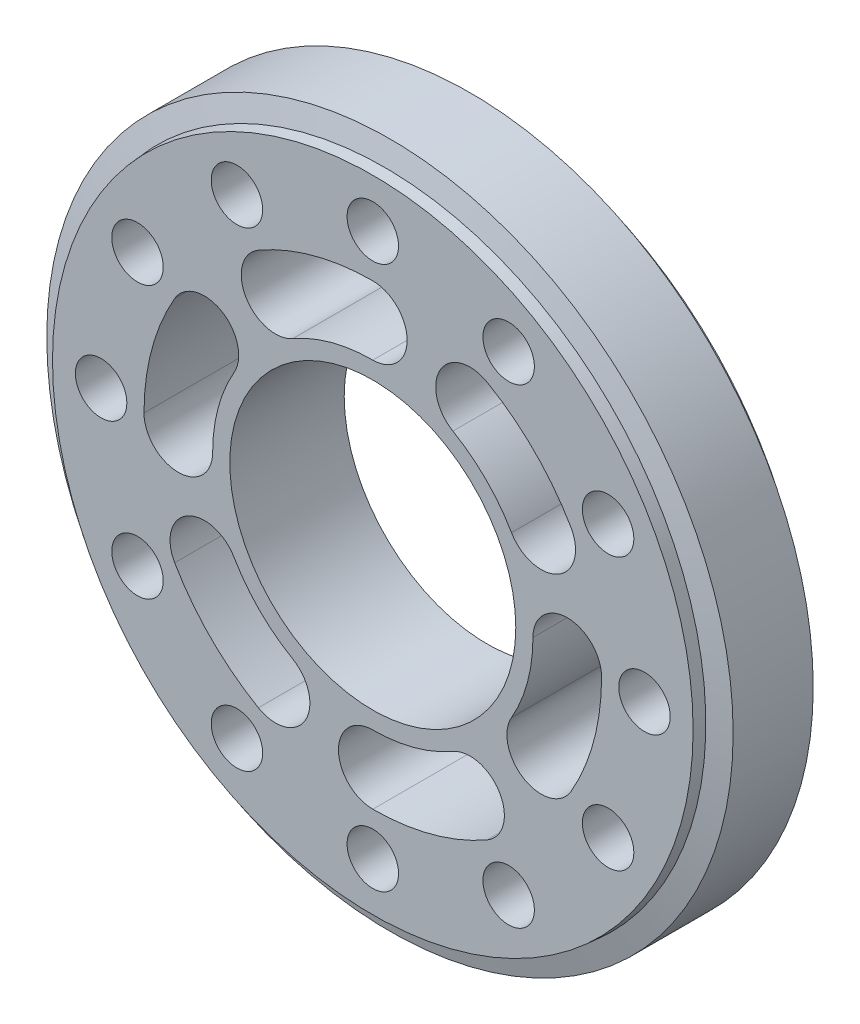
from build123d import *

# Parameters (mm, degrees)
SKETCH2_R          = 2.25
SKETCH2_R_2        = 12.5
CUT_EXTRUDE1_DEPTH = 12
CHAMFER1_SIZE2     = 2
CHAMFER1_SIZE      = 0.5
CHAMFER2_SIZE      = 0.5
CHAMFER2_SIZE_2    = 2
CUT_EXTRUDE2_DEPTH = 20
CIRPATTERN1_COUNT  = 6
DRAFT2_ANGLE       = 5


# Read off the part's stored shape, not the designer's step: Draft1
# Some blends are built 0.0001 mm under size
with BuildPart() as part:
    # Sketch1 → Revolve1 (revolve)
    with BuildSketch(Plane(origin=(0, 0, 0), x_dir=(0, 0, -1), z_dir=(1, 0, 0)), mode=Mode.PRIVATE) as revolve1_sk:
        Polygon((0, 0), (0, 30), (4, 30), (4, 28), (5, 28), (5, 0), align=None)
    revolve(revolve1_sk.sketch.rotate(Axis((0, 0, 0), (0, 0, 1)), 90), axis=Axis((0, 0, 0), (0, 0, 1)))

    # Mirror1: part across plane


with BuildPart() as part_1:
    add(part.part)
    add(part.part.mirror(Plane.XY))

    # Sketch2 → Cut-Extrude1 (cut)
    with BuildSketch(Plane.XY.offset(5)):
        with Locations((0, 23.75)):
            Circle(SKETCH2_R)
        with Locations((-11.875, 20.56810334)):
            Circle(SKETCH2_R)
        with Locations((-20.56810334, 11.875)):
            Circle(SKETCH2_R)
        with Locations((-23.75, 0)):
            Circle(SKETCH2_R)
        with Locations((-20.56810334, -11.875)):
            Circle(SKETCH2_R)
        with Locations((-11.875, -20.56810334)):
            Circle(SKETCH2_R)
        with Locations((0, -23.75)):
            Circle(SKETCH2_R)
        with Locations((11.875, -20.56810334)):
            Circle(SKETCH2_R)
        with Locations((20.56810334, -11.875)):
            Circle(SKETCH2_R)
        with Locations((20.56810334, 11.875)):
            Circle(SKETCH2_R)
        with Locations((11.875, 20.56810334)):
            Circle(SKETCH2_R)
        Circle(SKETCH2_R_2)
        with Locations((23.75, 0)):
            Circle(SKETCH2_R)
    extrude(amount=-CUT_EXTRUDE1_DEPTH, mode=Mode.SUBTRACT)

    # Chamfer1
    chamfer1_edges = [part_1.edges().sort_by_distance(p)[0] for p in [
        (30, 0, 4),
    ]]
    chamfer1_side = [part_1.faces().sort_by_distance(p)[0] for p in [
        (30, 0, 3.99),
    ]]
    chamfer(chamfer1_edges, length=CHAMFER1_SIZE - 0.0001, length2=CHAMFER1_SIZE2 - 0.0001, reference=chamfer1_side[0])  # a hair under: the kernel refuses the full size

    # Chamfer2
    # the kernel refuses this chamfer: 2, 0.5 mm, written as the material it takes off along each edge
    with BuildSketch(Plane(origin=(0, 0, -4), x_dir=(-1, 0, 0), z_dir=(0, 1, 0))) as chamfer2_piece_1:
        Polygon((30, CHAMFER2_SIZE), (30 - CHAMFER2_SIZE_2, 0), (30, 0), align=None)
    revolve(axis=Axis((0, 0, -4), (0, 0, 1)), mode=Mode.SUBTRACT)

    # Sketch3 → Cut-Extrude2 (cut)
    with BuildSketch(Plane(origin=(0, 0, -5), x_dir=(-1, 0, 0), z_dir=(0, 0, -1))):
        with BuildLine():
            ThreePointArc((10, 17.320508076), (5.176380902, 19.318516526), (0, 20))
            ThreePointArc((0, 20), (-3, 17), (0, 14))
            ThreePointArc((0, 14), (3.623466631, 13.522961568), (7, 12.124355653))
            ThreePointArc((7, 12.124355653), (11.098076211, 13.222431864), (10, 17.320508076))
        make_face()
    cut_extrude2 = extrude(amount=-CUT_EXTRUDE2_DEPTH, mode=Mode.SUBTRACT)

    # CirPattern1: Cut-Extrude2 ×6 about axis
    cirpattern1_axis = Axis((0, 0, 0), (0, 0, 1))
    for i in range(1, CIRPATTERN1_COUNT):
        add(cut_extrude2.rotate(cirpattern1_axis, i * 360 / CIRPATTERN1_COUNT), mode=Mode.SUBTRACT)

    # Draft1 outline → Draft1 (revolve)
    with BuildSketch(Plane.XZ):
        Polygon((28, 5), (28, 3.977638745), (28.08944502, 3.977638745), align=None)
    revolve(axis=Axis((0, 0, 0), (0, 0, 1)))

    # Draft2
    draft2_faces = [part_1.faces().sort_by_distance(p)[0] for p in [
        (28, 0, -4.5),
    ]]
    draft(draft2_faces, Plane(origin=(0, 28, -5), x_dir=(-1, 0, 0), z_dir=(0, 0, -1)), DRAFT2_ANGLE)


solid = part_1.part
